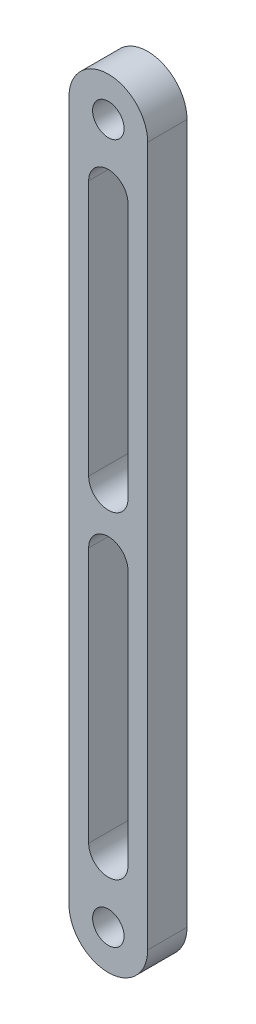
from build123d import *

# Parameters (mm, degrees)
SKETCH1_R           = 4
BOSS_EXTRUDE1_DEPTH = 10


with BuildPart() as part:
    # Sketch1 → Boss-Extrude1 (new body)
    with BuildSketch(Plane.XY):
        with BuildLine():
            Line((-10, -88.9), (-10, 88.9))
            ThreePointArc((-10, 88.9), (0, 98.9), (10, 88.9))
            Line((10, 88.9), (10, -88.9))
            ThreePointArc((10, -88.9), (0, -98.9), (-10, -88.9))
        make_face()
        with Locations((0, -88.9)):
            Circle(SKETCH1_R, mode=Mode.SUBTRACT)
        with Locations((0, 88.9)):
            Circle(SKETCH1_R, mode=Mode.SUBTRACT)
        with BuildLine():
            Line((-5, -72.9), (-5, -7.9))
            ThreePointArc((-5, -7.9), (0, -2.9), (5, -7.9))
            Line((5, -7.9), (5, -72.9))
            ThreePointArc((5, -72.9), (0, -77.9), (-5, -72.9))
        make_face(mode=Mode.SUBTRACT)
        with BuildLine():
            Line((5, 72.9), (5, 7.9))
            ThreePointArc((5, 7.9), (0, 2.9), (-5, 7.9))
            Line((-5, 7.9), (-5, 72.9))
            ThreePointArc((-5, 72.9), (0, 77.9), (5, 72.9))
        make_face(mode=Mode.SUBTRACT)
    extrude(amount=BOSS_EXTRUDE1_DEPTH)


solid = part.part
